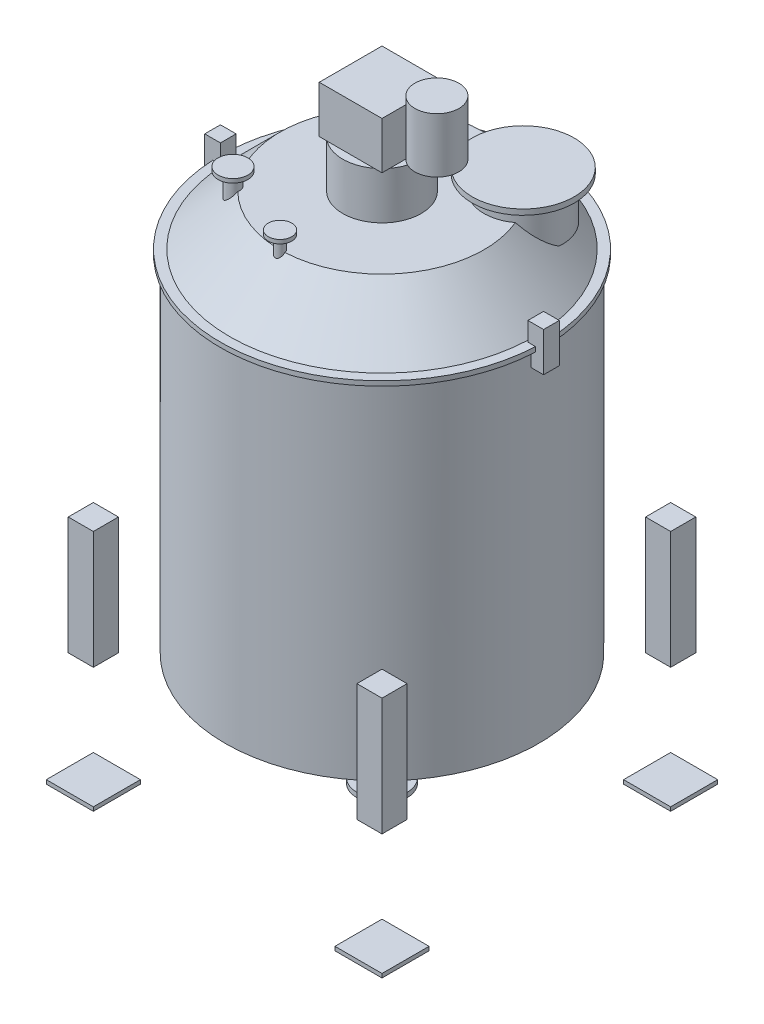
from build123d import *

# Parameters (mm, degrees)
SKETCH1_R              = 1000
BOSS_EXTRUDE1_DEPTH    = 2200
SKETCH2_R              = 1000
BOSS_EXTRUDE2_DEPTH    = 500
BOSS_EXTRUDE2_TAPER    = 45
SKETCH3_R              = 100
BOSS_EXTRUDE3_DEPTH    = 750
BOSS_EXTRUDE4_START    = -720
SKETCH4_R              = 160
BOSS_EXTRUDE4_DEPTH    = 30
BOSS_EXTRUDE5_START    = 2200
SKETCH5_R              = 1030
BOSS_EXTRUDE5_DEPTH    = 30
BOSS_EXTRUDE6_START    = 2200
SKETCH6_R              = 1000
BOSS_EXTRUDE6_DEPTH    = 350
BOSS_EXTRUDE6_TAPER    = 45
BOSS_EXTRUDE7_START    = 2550
SKETCH7_R              = 250
BOSS_EXTRUDE7_DEPTH    = 300
BOSS_EXTRUDE8_START    = 2850
SKETCH8_W              = 400
SKETCH8_H              = 400
BOSS_EXTRUDE8_DEPTH    = 300
BOSS_EXTRUDE9_START    = 2900
SKETCH9_R              = 140
BOSS_EXTRUDE9_DEPTH    = 350
BOSS_EXTRUDE10_START   = 2380
SKETCH10_R             = 250
BOSS_EXTRUDE10_DEPTH   = 300
BOSS_EXTRUDE11_START   = 2645
SKETCH11_R             = 325
BOSS_EXTRUDE11_DEPTH   = 35
BOSS_EXTRUDE12_START   = 2380
SKETCH12_R             = 84
BOSS_EXTRUDE12_DEPTH   = 300
BOSS_EXTRUDE13_START   = 2650
SKETCH13_R             = 140
BOSS_EXTRUDE13_DEPTH   = 30
BOSS_EXTRUDE14_START   = 2380
SKETCH14_R             = 30
SKETCH14_R_2           = 45
BOSS_EXTRUDE14_DEPTH   = 280
BOSS_EXTRUDE15_START   = 2635
SKETCH15_R             = 75
SKETCH15_R_2           = 95
BOSS_EXTRUDE15_DEPTH   = 25
SKETCH16_W             = 160
SKETCH16_H             = 160
BOSS_EXTRUDE16_DEPTH   = 750
BOSS_EXTRUDE16_2_DEPTH = 750
BOSS_EXTRUDE16_3_DEPTH = 750
BOSS_EXTRUDE16_4_DEPTH = 750
BOSS_EXTRUDE17_START   = -725
SKETCH17_W             = 300
SKETCH17_H             = 300
BOSS_EXTRUDE17_DEPTH   = 25
BOSS_EXTRUDE17_2_DEPTH = 25
BOSS_EXTRUDE17_3_DEPTH = 25
BOSS_EXTRUDE17_4_DEPTH = 25
BOSS_EXTRUDE18_START   = 2100
SKETCH18_W             = 100
SKETCH18_H             = 100
BOSS_EXTRUDE18_DEPTH   = 250


with BuildPart() as part:
    # Sketch1 → Boss-Extrude1 (new body)
    with BuildSketch(Plane(origin=(0, 0, 0), x_dir=(1, 0, 0), z_dir=(0, 1, 0))):
        Circle(SKETCH1_R)
    extrude(amount=BOSS_EXTRUDE1_DEPTH)

    # Sketch2 → Boss-Extrude2 (add)
    with BuildSketch(Plane(origin=(0, 0, 0), x_dir=(1, 0, 0), z_dir=(0, 1, 0))):
        Circle(SKETCH2_R)
    extrude(amount=BOSS_EXTRUDE2_DEPTH, taper=BOSS_EXTRUDE2_TAPER)

    # Sketch3 → Boss-Extrude3 (add)
    with BuildSketch(Plane(origin=(0, 0, 0), x_dir=(1, 0, 0), z_dir=(0, 1, 0))):
        Circle(SKETCH3_R)
    extrude(amount=BOSS_EXTRUDE3_DEPTH)

    # Sketch5 → Boss-Extrude5 (add)
    with BuildSketch(Plane(origin=(0, 0, 0), x_dir=(1, 0, 0), z_dir=(0, 1, 0)).offset(BOSS_EXTRUDE5_START)):
        Circle(SKETCH5_R)
    extrude(amount=BOSS_EXTRUDE5_DEPTH)

    # Sketch6 → Boss-Extrude6 (add)
    with BuildSketch(Plane(origin=(0, 0, 0), x_dir=(1, 0, 0), z_dir=(0, 1, 0)).offset(BOSS_EXTRUDE6_START)):
        Circle(SKETCH6_R)
    extrude(amount=BOSS_EXTRUDE6_DEPTH, taper=BOSS_EXTRUDE6_TAPER)

    # Sketch7 → Boss-Extrude7 (add)
    with BuildSketch(Plane(origin=(0, 0, 0), x_dir=(1, 0, 0), z_dir=(0, 1, 0)).offset(BOSS_EXTRUDE7_START)):
        Circle(SKETCH7_R)
    extrude(amount=BOSS_EXTRUDE7_DEPTH)

    # Sketch8 → Boss-Extrude8 (add)
    with BuildSketch(Plane(origin=(0, 0, 0), x_dir=(1, 0, 0), z_dir=(0, 1, 0)).offset(BOSS_EXTRUDE8_START)):
        Rectangle(SKETCH8_W, SKETCH8_H)
    extrude(amount=BOSS_EXTRUDE8_DEPTH)

    # Sketch10 → Boss-Extrude10 (add)
    with BuildSketch(Plane(origin=(0, 0, 0), x_dir=(1, 0, 0), z_dir=(0, 1, 0)).offset(BOSS_EXTRUDE10_START)):
        with Locations((450, 450)):
            Circle(SKETCH10_R)
    extrude(amount=BOSS_EXTRUDE10_DEPTH)

    # Sketch11 → Boss-Extrude11 (add)
    with BuildSketch(Plane(origin=(0, 0, 0), x_dir=(1, 0, 0), z_dir=(0, 1, 0)).offset(BOSS_EXTRUDE11_START)):
        with Locations((450, 450)):
            Circle(SKETCH11_R)
    extrude(amount=BOSS_EXTRUDE11_DEPTH)

    # Sketch12 → Boss-Extrude12 (add)
    with BuildSketch(Plane(origin=(0, 0, 0), x_dir=(1, 0, 0), z_dir=(0, 1, 0)).offset(BOSS_EXTRUDE12_START)):
        with Locations((-500, 450)):
            Circle(SKETCH12_R)
    extrude(amount=BOSS_EXTRUDE12_DEPTH)

    # Sketch13 → Boss-Extrude13 (add)
    with BuildSketch(Plane(origin=(0, 0, 0), x_dir=(1, 0, 0), z_dir=(0, 1, 0)).offset(BOSS_EXTRUDE13_START)):
        with Locations((-500, 450)):
            Circle(SKETCH13_R)
    extrude(amount=BOSS_EXTRUDE13_DEPTH)

    # Sketch14 → Boss-Extrude14 (add)
    with BuildSketch(Plane(origin=(0, 0, 0), x_dir=(1, 0, 0), z_dir=(0, 1, 0)).offset(BOSS_EXTRUDE14_START)):
        with Locations((0, -650)):
            Circle(SKETCH14_R)
        with Locations((-500, -450)):
            Circle(SKETCH14_R_2)
    extrude(amount=BOSS_EXTRUDE14_DEPTH)

    # Sketch15 → Boss-Extrude15 (add)
    with BuildSketch(Plane(origin=(0, 0, 0), x_dir=(1, 0, 0), z_dir=(0, 1, 0)).offset(BOSS_EXTRUDE15_START)):
        with Locations((0, -650)):
            Circle(SKETCH15_R)
        with Locations((-500, -450)):
            Circle(SKETCH15_R_2)
    extrude(amount=BOSS_EXTRUDE15_DEPTH)

    # Sketch18 → Boss-Extrude18 (add)
    with BuildSketch(Plane(origin=(0, 0, 0), x_dir=(1, 0, 0), z_dir=(0, 1, 0)).offset(BOSS_EXTRUDE18_START)):
        with Locations((1030, 0)):
            Rectangle(SKETCH18_W, SKETCH18_H)
        with Locations((-1030, 0)):
            Rectangle(SKETCH18_W, SKETCH18_H)
    extrude(amount=BOSS_EXTRUDE18_DEPTH)


with BuildPart() as body_2:
    # Sketch4 → Boss-Extrude4 (new body)
    with BuildSketch(Plane(origin=(0, 0, 0), x_dir=(1, 0, 0), z_dir=(0, 1, 0)).offset(BOSS_EXTRUDE4_START)):
        Circle(SKETCH4_R)
    extrude(amount=BOSS_EXTRUDE4_DEPTH)


with BuildPart() as body_3:
    # Sketch9 → Boss-Extrude9 (new body)
    with BuildSketch(Plane(origin=(0, 0, 0), x_dir=(1, 0, 0), z_dir=(0, 1, 0)).offset(BOSS_EXTRUDE9_START)):
        with Locations((350, 0)):
            Circle(SKETCH9_R)
    extrude(amount=BOSS_EXTRUDE9_DEPTH)


with BuildPart() as body_4:
    # Sketch16 → Boss-Extrude16 (new body)
    with BuildSketch(Plane(origin=(0, 0, 0), x_dir=(1, 0, 0), z_dir=(0, 1, 0))):
        with Locations((920, 920)):
            Rectangle(SKETCH16_W, SKETCH16_H)
    extrude(amount=BOSS_EXTRUDE16_DEPTH)


with BuildPart() as body_5:
    # Sketch16 → Boss-Extrude16 2 (new body)
    with BuildSketch(Plane(origin=(0, 0, 0), x_dir=(1, 0, 0), z_dir=(0, 1, 0))):
        with Locations((-920, 920)):
            Rectangle(SKETCH16_W, SKETCH16_H)
    extrude(amount=BOSS_EXTRUDE16_2_DEPTH)


with BuildPart() as body_6:
    # Sketch16 → Boss-Extrude16 3 (new body)
    with BuildSketch(Plane(origin=(0, 0, 0), x_dir=(1, 0, 0), z_dir=(0, 1, 0))):
        with Locations((-920, -920)):
            Rectangle(SKETCH16_W, SKETCH16_H)
    extrude(amount=BOSS_EXTRUDE16_3_DEPTH)


with BuildPart() as body_7:
    # Sketch16 → Boss-Extrude16 4 (new body)
    with BuildSketch(Plane(origin=(0, 0, 0), x_dir=(1, 0, 0), z_dir=(0, 1, 0))):
        with Locations((920, -920)):
            Rectangle(SKETCH16_W, SKETCH16_H)
    extrude(amount=BOSS_EXTRUDE16_4_DEPTH)


with BuildPart() as body_8:
    # Sketch17 → Boss-Extrude17 (new body)
    with BuildSketch(Plane(origin=(0, 0, 0), x_dir=(1, 0, 0), z_dir=(0, 1, 0)).offset(BOSS_EXTRUDE17_START)):
        with Locations((920, 920)):
            Rectangle(SKETCH17_W, SKETCH17_H)
    extrude(amount=BOSS_EXTRUDE17_DEPTH)


with BuildPart() as body_9:
    # Sketch17 → Boss-Extrude17 2 (new body)
    with BuildSketch(Plane(origin=(0, 0, 0), x_dir=(1, 0, 0), z_dir=(0, 1, 0)).offset(BOSS_EXTRUDE17_START)):
        with Locations((-920, 920)):
            Rectangle(SKETCH17_W, SKETCH17_H)
    extrude(amount=BOSS_EXTRUDE17_2_DEPTH)


with BuildPart() as body_10:
    # Sketch17 → Boss-Extrude17 3 (new body)
    with BuildSketch(Plane(origin=(0, 0, 0), x_dir=(1, 0, 0), z_dir=(0, 1, 0)).offset(BOSS_EXTRUDE17_START)):
        with Locations((-920, -920)):
            Rectangle(SKETCH17_W, SKETCH17_H)
    extrude(amount=BOSS_EXTRUDE17_3_DEPTH)


with BuildPart() as body_11:
    # Sketch17 → Boss-Extrude17 4 (new body)
    with BuildSketch(Plane(origin=(0, 0, 0), x_dir=(1, 0, 0), z_dir=(0, 1, 0)).offset(BOSS_EXTRUDE17_START)):
        with Locations((920, -920)):
            Rectangle(SKETCH17_W, SKETCH17_H)
    extrude(amount=BOSS_EXTRUDE17_4_DEPTH)


solid = Compound([part.part, body_2.part, body_3.part, body_4.part, body_5.part, body_6.part, body_7.part, body_8.part, body_9.part, body_10.part, body_11.part])
